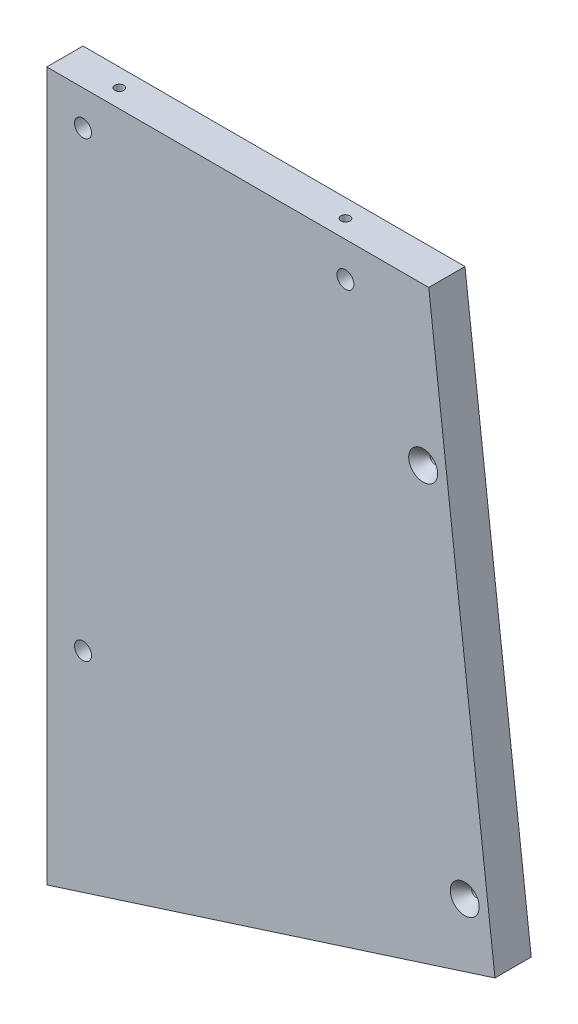
from build123d import *

# Parameters (mm, degrees)
BOSS_EXTRUDE1_DEPTH              = 12.7
HOLE3_D                          = 3.175
HOLE3_DEPTH                      = 31.75
HOLE3_CSINK_D                    = 10.16
HOLE3_CSINK_ANGLE                = 82
HOLE3_TIP                        = 0.953866233
HOLE6_D                          = 3.175
HOLE6_DEPTH                      = 38.1
HOLE6_CSINK_D                    = 10.16
HOLE6_CSINK_ANGLE                = 82
HOLE6_TIP                        = 0.953866233
HOLE7_D                          = 3.175
HOLE7_DEPTH                      = 31.75
HOLE7_CSINK_D                    = 10.16
HOLE7_CSINK_ANGLE                = 82
HOLE7_TIP                        = 0.953866233
HOLE8_D                          = 3.175
HOLE8_DEPTH                      = 31.75
HOLE8_CSINK_D                    = 10.16
HOLE8_CSINK_ANGLE                = 82
HOLE8_TIP                        = 0.953866233
F_15_64_0_23438_DIAMETER_HOLE1_D = 5.953252
F_15_64_0_23438_DIAMETER_HOLE2_D = 5.953252


with BuildPart() as part:
    # Sketch1 → Boss-Extrude1 (new body)
    with BuildSketch(Plane.XY):
        Polygon((-88.190159952, 0), (-222.052967181, 0), (-222.052967181, -248.25), (-64.977416983, -197.966048293), align=None)
    extrude(amount=-BOSS_EXTRUDE1_DEPTH)

    # Hole3
    with Locations(Plane(origin=(-234.752967181, 1073.364195846, -135.816741379), x_dir=(0, 0, -1), z_dir=(-1, 0, 0))):
        with Locations((-129.466741379, 1300.662770337), (-129.466741379, 1128.612770337), (129.198788767, 1128.612770337), (129.198788767, 1300.662770337)):
            CounterSinkHole(HOLE3_D / 2, HOLE3_CSINK_D / 2, depth=HOLE3_DEPTH, counter_sink_angle=HOLE3_CSINK_ANGLE)
            with Locations((0, 0, -(HOLE3_DEPTH + HOLE3_TIP / 2))):  # 118° drill point
                Cone(0, HOLE3_D / 2, HOLE3_TIP, mode=Mode.SUBTRACT)

    # Hole6
    with Locations(Plane(origin=(181.039434513, 1073.364195846, 0), x_dir=(-0.9271838545667885, -0.3746065934159093, 0), z_dir=(0, 0, 1))):
        with Locations((707.166557203, 1065.270372796), (674.127983646, 944.603090451)):
            CounterSinkHole(HOLE6_D / 2, HOLE6_CSINK_D / 2, depth=HOLE6_DEPTH, counter_sink_angle=HOLE6_CSINK_ANGLE)
            with Locations((0, 0, -(HOLE6_DEPTH + HOLE6_TIP / 2))):  # 118° drill point
                Cone(0, HOLE6_D / 2, HOLE6_TIP, mode=Mode.SUBTRACT)

    # Hole7
    with Locations(Plane(origin=(181.039434513, 12.7, -135.816741379), x_dir=(0, 0, -1), z_dir=(0, 1, 0))):
        with Locations((129.198788767, 384.042401694), (-129.466741379, 384.042401694), (-129.466741379, 304.786761906), (-110.416741379, 409.442401694), (-0.133976306, 409.442401694), (110.148788767, 409.442401694), (129.198788767, 304.786761906)):
            CounterSinkHole(HOLE7_D / 2, HOLE7_CSINK_D / 2, depth=HOLE7_DEPTH, counter_sink_angle=HOLE7_CSINK_ANGLE)
            with Locations((0, 0, -(HOLE7_DEPTH + HOLE7_TIP / 2))):  # 118° drill point
                Cone(0, HOLE7_D / 2, HOLE7_TIP, mode=Mode.SUBTRACT)

    # Hole8
    with Locations(Plane(origin=(531.197640696, -20.449854654, -135.816741379), x_dir=(0, 0, 1), z_dir=(0.3048844921716131, -0.9523893355310409, 0))):
        with Locations((-129.257383629, 761.035393152), (129.466741379, 663.01461615), (129.466741379, 760.835922116), (-129.408220012, 663.214203478)):
            CounterSinkHole(HOLE8_D / 2, HOLE8_CSINK_D / 2, depth=HOLE8_DEPTH, counter_sink_angle=HOLE8_CSINK_ANGLE)
            with Locations((0, 0, -(HOLE8_DEPTH + HOLE8_TIP / 2))):  # 118° drill point
                Cone(0, HOLE8_D / 2, HOLE8_TIP, mode=Mode.SUBTRACT)

    # 15/64 (0.23438) Diameter Hole1 (through all)
    with Locations(Plane.XY):
        with Locations((-117.397327374, -12.17947903), (-209.352967162, -12.179479032)):
            Hole(F_15_64_0_23438_DIAMETER_HOLE1_D / 2)

    # 15/64 (0.23438) Diameter Hole2 (through all)
    with Locations(Plane.XY):
        with Locations((-209.352967181, -170.846075828)):
            Hole(F_15_64_0_23438_DIAMETER_HOLE2_D / 2)


solid = part.part
